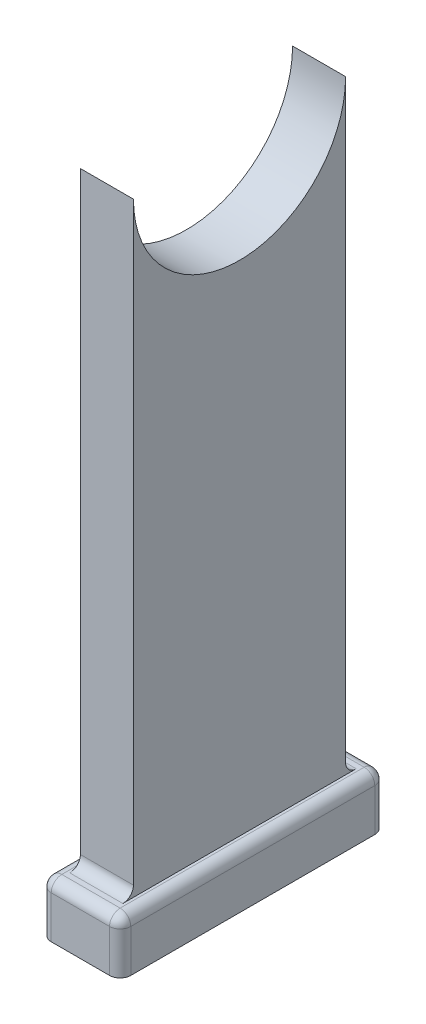
from build123d import *

# Parameters (mm, degrees)
SKETCH_1_W      = 15
SKETCH_1_H      = 50
EXTRUDE_1_DEPTH = 10
FILLET_1_R      = 2
FILLET_2_R      = 2
EXTRUDE_3_DEPTH = 5
FILLET_3_R      = 2


with BuildPart() as part:
    # 스케치1 → 보스-돌출1 (new body)
    with BuildSketch(Plane(origin=(0, 0, 0), x_dir=(1, 0, 0), z_dir=(0, 1, 0))):
        Rectangle(SKETCH_1_W, SKETCH_1_H)
    extrude(amount=EXTRUDE_1_DEPTH)

    # 필렛1
    fillet_1_edges = [part.edges().sort_by_distance(p)[0] for p in [
        (7.5, 10, 0),
        (0, 10, -25),
        (-7.5, 10, 0),
        (0, 10, 25),
    ]]
    fillet(fillet_1_edges, radius=FILLET_1_R)

    # 필렛2
    # the kernel refuses this fillet: 2 mm, written as the material it takes off along each edge
    with BuildSketch(Plane(origin=(-5.5, 8, 23), x_dir=(-1, 0, 0), z_dir=(0, 0, 1))) as fillet_2_piece_1_section:
        Polygon((0, 0), (FILLET_2_R, 0), (FILLET_2_R, -FILLET_2_R), (0, -FILLET_2_R), align=None)
    fillet_2_piece_1 = extrude(amount=FILLET_2_R, mode=Mode.PRIVATE)
    fillet_2_piece_1 = fillet_2_piece_1 - Plane(origin=(-5.5, 8, 23), x_dir=(0.7071067811865475, -0.7071067811865475, 0), z_dir=(0, 0, 1)) * Sphere(FILLET_2_R, mode=Mode.PRIVATE)
    add(fillet_2_piece_1, mode=Mode.SUBTRACT)
    with BuildSketch(Plane(origin=(-5.5, 8, -23), x_dir=(0, 0, -1), z_dir=(-1, 0, 0))) as fillet_2_piece_2_section:
        Polygon((0, 0), (FILLET_2_R, 0), (FILLET_2_R, -FILLET_2_R), (0, -FILLET_2_R), align=None)
    fillet_2_piece_2 = extrude(amount=FILLET_2_R, mode=Mode.PRIVATE)
    fillet_2_piece_2 = fillet_2_piece_2 - Plane(origin=(-5.5, 8, -23), x_dir=(0, -0.7071067811865475, 0.7071067811865475), z_dir=(-1, 0, 0)) * Sphere(FILLET_2_R, mode=Mode.PRIVATE)
    add(fillet_2_piece_2, mode=Mode.SUBTRACT)
    with BuildSketch(Plane(origin=(5.5, 8, 23), x_dir=(1, 0, 0), z_dir=(0, 0, 1))) as fillet_2_piece_3_section:
        Polygon((0, 0), (FILLET_2_R, 0), (FILLET_2_R, FILLET_2_R), (0, FILLET_2_R), align=None)
    fillet_2_piece_3 = extrude(amount=FILLET_2_R, mode=Mode.PRIVATE)
    fillet_2_piece_3 = fillet_2_piece_3 - Plane(origin=(5.5, 8, 23), x_dir=(-0.7071067811865475, -0.7071067811865475, 0), z_dir=(0, 0, 1)) * Sphere(FILLET_2_R, mode=Mode.PRIVATE)
    add(fillet_2_piece_3, mode=Mode.SUBTRACT)
    with BuildSketch(Plane(origin=(5.5, 8, -23), x_dir=(0, 0, -1), z_dir=(1, 0, 0))) as fillet_2_piece_4_section:
        Polygon((0, 0), (FILLET_2_R, 0), (FILLET_2_R, FILLET_2_R), (0, FILLET_2_R), align=None)
    fillet_2_piece_4 = extrude(amount=FILLET_2_R, mode=Mode.PRIVATE)
    fillet_2_piece_4 = fillet_2_piece_4 - Plane(origin=(5.5, 8, -23), x_dir=(0, -0.7071067811865475, 0.7071067811865475), z_dir=(1, 0, 0)) * Sphere(FILLET_2_R, mode=Mode.PRIVATE)
    add(fillet_2_piece_4, mode=Mode.SUBTRACT)
    with BuildSketch(Plane(origin=(7.5, -5, -25), x_dir=(0, 0, 1), z_dir=(0, 1, 0)), Plane(origin=(7.5, -5, 25), x_dir=(-1, 0, 0), z_dir=(0, 1, 0))) as fillet_2_piece_5:
        with BuildLine():
            CenterArc((FILLET_2_R, -FILLET_2_R), FILLET_2_R, 90, 90)
            Line((0, -FILLET_2_R), (0, 0))
            Line((0, 0), (FILLET_2_R, 0))
        make_face()
    extrude(amount=13, mode=Mode.SUBTRACT)
    with BuildSketch(Plane(origin=(-7.5, -5, 25), x_dir=(1, 0, 0), z_dir=(0, 1, 0)), Plane(origin=(-7.5, -5, -25), x_dir=(0, 0, 1), z_dir=(0, 1, 0))) as fillet_2_piece_6:
        with BuildLine():
            CenterArc((FILLET_2_R, FILLET_2_R), FILLET_2_R, 180, 90)
            Line((0, FILLET_2_R), (0, 0))
            Line((0, 0), (FILLET_2_R, 0))
        make_face()
    extrude(amount=13, mode=Mode.SUBTRACT)

    # 스케치4 → 보스-돌출3 (add, symmetric)
    with BuildSketch(Plane(origin=(0, 0, 0), x_dir=(0, 0, -1), z_dir=(1, 0, 0))):
        with BuildLine():
            Line((20, 0), (-20, 0))
            Line((-20, 0), (-20, 104))
            Line((-20, 104), (-20, 124))
            ThreePointArc((-20, 124), (0, 104), (20, 124))
            Line((20, 124), (20, 104))
            Line((20, 104), (20, 0))
        make_face()
    extrude(amount=EXTRUDE_3_DEPTH, both=True)

    # 필렛3
    fillet_3_edges = [part.edges().sort_by_distance(p)[0] for p in [
        (0, 10, -20),
        (0, 10, 20),
    ]]
    fillet(fillet_3_edges, radius=FILLET_3_R)


solid = part.part
